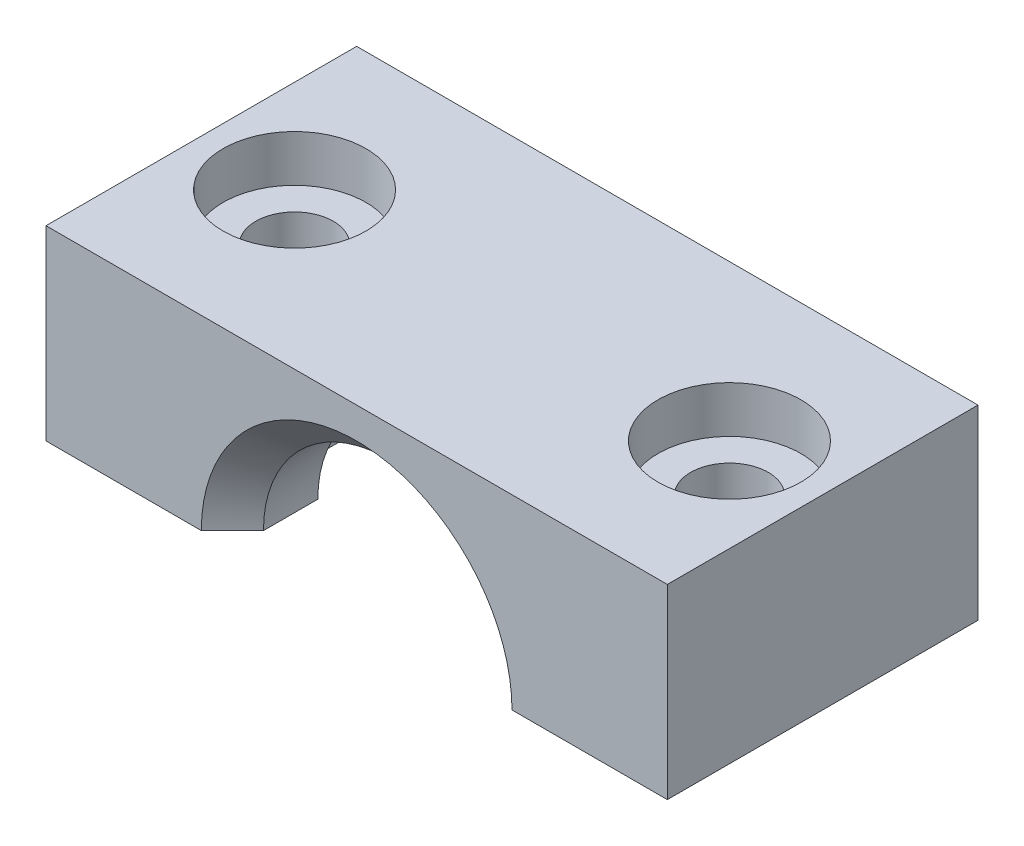
from build123d import *

# Parameters (mm, degrees)
SKETCH_2_W             = 20
SKETCH_2_H             = 6
EXTRUDE_379_DEPTH      = 5
SKETCH_3_R             = 4
CUT_EXTRUDE_526_DEPTH  = 16.362291496
SKETCH_4_R             = 5.25
CUT_EXTRUDE_602_DEPTH  = 2.25
SKETCH_5_R             = 1.25
CUT_EXTRUDE_755_DEPTH  = 13.68857754
CHAMFER_2_SIZE         = 1
SKETCH_6_R             = 2.3
CUT_EXTRUDE_1018_DEPTH = 1.5


with BuildPart() as part:
    # Эскиз2 → Extrude 379 (new, symmetric)
    with BuildSketch(Plane.XY):
        with Locations((0, 3)):
            Rectangle(SKETCH_2_W, SKETCH_2_H)
    extrude(amount=EXTRUDE_379_DEPTH, both=True)

    # Эскиз3 → Cut-Extrude 526 (cut, through all)
    with BuildSketch(Plane.XY.offset(5)):
        Circle(SKETCH_3_R)
    extrude(amount=-CUT_EXTRUDE_526_DEPTH, mode=Mode.SUBTRACT)

    # Эскиз4 → Cut-Extrude 602 (cut, symmetric)
    with BuildSketch(Plane.XY):
        Circle(SKETCH_4_R)
    extrude(amount=CUT_EXTRUDE_602_DEPTH, both=True, mode=Mode.SUBTRACT)

    # Эскиз5 → Cut-Extrude 755 (cut, through all)
    with BuildSketch(Plane(origin=(0, 6, 0), x_dir=(1, 0, 0), z_dir=(0, 1, 0))):
        with Locations((-7, 0)):
            Circle(SKETCH_5_R)
        with Locations((7, 0)):
            Circle(SKETCH_5_R)
    extrude(amount=-CUT_EXTRUDE_755_DEPTH, mode=Mode.SUBTRACT)

    # Фаска2
    chamfer_2_edges = [part.edges().sort_by_distance(p)[0] for p in [
        (0, 4, -5),
        (0, 4, 5),
    ]]
    chamfer(chamfer_2_edges, length=CHAMFER_2_SIZE)

    # Эскиз6 → Cut-Extrude 1018 (cut)
    with BuildSketch(Plane(origin=(0, 6, 0), x_dir=(1, 0, 0), z_dir=(0, 1, 0))):
        with Locations((-7, 0)):
            Circle(SKETCH_6_R)
        with Locations((7, 0)):
            Circle(SKETCH_6_R)
    extrude(amount=-CUT_EXTRUDE_1018_DEPTH, mode=Mode.SUBTRACT)


solid = part.part
